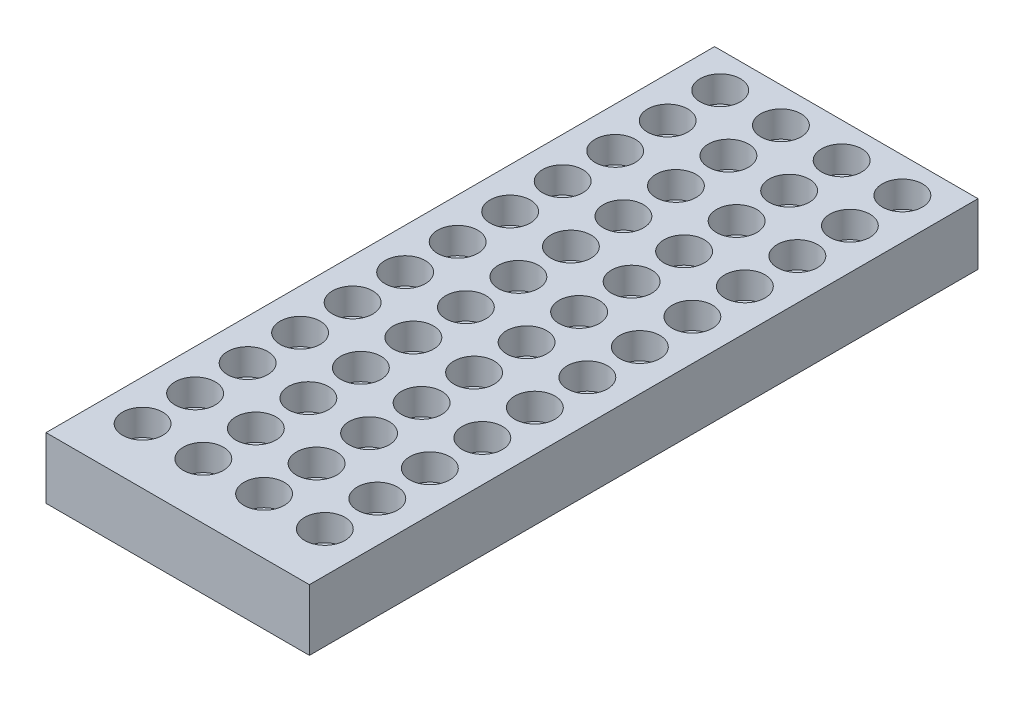
from build123d import *

# Parameters (mm, degrees)
SKETCH1_W           = 75.25
SKETCH1_H           = 191
SKETCH1_R           = 5.75
BOSS_EXTRUDE1_DEPTH = 7.5
SKETCH3_W           = 75.25
SKETCH3_H           = 191
BOSS_EXTRUDE2_DEPTH = 10


with BuildPart() as part:
    # Sketch1 → Boss-Extrude1 (new body)
    with BuildSketch(Plane(origin=(0, 0, 0), x_dir=(1, 0, 0), z_dir=(0, 1, 0))):
        Rectangle(SKETCH1_W, SKETCH1_H)
        with Locations((-26.025, 85.5)):
            Circle(SKETCH1_R, mode=Mode.SUBTRACT)
        with Locations((-8.675, 85.5)):
            Circle(SKETCH1_R, mode=Mode.SUBTRACT)
        with Locations((8.675, 85.5)):
            Circle(SKETCH1_R, mode=Mode.SUBTRACT)
        with Locations((26.025, 85.5)):
            Circle(SKETCH1_R, mode=Mode.SUBTRACT)
        with Locations((-26.025, 70.5)):
            Circle(SKETCH1_R, mode=Mode.SUBTRACT)
        with Locations((-8.675, 70.5)):
            Circle(SKETCH1_R, mode=Mode.SUBTRACT)
        with Locations((8.675, 70.5)):
            Circle(SKETCH1_R, mode=Mode.SUBTRACT)
        with Locations((26.025, 70.5)):
            Circle(SKETCH1_R, mode=Mode.SUBTRACT)
        with Locations((-26.025, 55.5)):
            Circle(SKETCH1_R, mode=Mode.SUBTRACT)
        with Locations((-8.675, 55.5)):
            Circle(SKETCH1_R, mode=Mode.SUBTRACT)
        with Locations((8.675, 55.5)):
            Circle(SKETCH1_R, mode=Mode.SUBTRACT)
        with Locations((26.025, 55.5)):
            Circle(SKETCH1_R, mode=Mode.SUBTRACT)
        with Locations((-26.025, 40.5)):
            Circle(SKETCH1_R, mode=Mode.SUBTRACT)
        with Locations((-8.675, 40.5)):
            Circle(SKETCH1_R, mode=Mode.SUBTRACT)
        with Locations((8.675, 40.5)):
            Circle(SKETCH1_R, mode=Mode.SUBTRACT)
        with Locations((26.025, 40.5)):
            Circle(SKETCH1_R, mode=Mode.SUBTRACT)
        with Locations((-26.025, 25.5)):
            Circle(SKETCH1_R, mode=Mode.SUBTRACT)
        with Locations((-8.675, 25.5)):
            Circle(SKETCH1_R, mode=Mode.SUBTRACT)
        with Locations((8.675, 25.5)):
            Circle(SKETCH1_R, mode=Mode.SUBTRACT)
        with Locations((26.025, 25.5)):
            Circle(SKETCH1_R, mode=Mode.SUBTRACT)
        with Locations((-26.025, 10.5)):
            Circle(SKETCH1_R, mode=Mode.SUBTRACT)
        with Locations((-8.675, 10.5)):
            Circle(SKETCH1_R, mode=Mode.SUBTRACT)
        with Locations((8.675, 10.5)):
            Circle(SKETCH1_R, mode=Mode.SUBTRACT)
        with Locations((26.025, 10.5)):
            Circle(SKETCH1_R, mode=Mode.SUBTRACT)
        with Locations((-26.025, -4.5)):
            Circle(SKETCH1_R, mode=Mode.SUBTRACT)
        with Locations((-8.675, -4.5)):
            Circle(SKETCH1_R, mode=Mode.SUBTRACT)
        with Locations((8.675, -4.5)):
            Circle(SKETCH1_R, mode=Mode.SUBTRACT)
        with Locations((26.025, -4.5)):
            Circle(SKETCH1_R, mode=Mode.SUBTRACT)
        with Locations((-26.025, -19.5)):
            Circle(SKETCH1_R, mode=Mode.SUBTRACT)
        with Locations((-8.675, -19.5)):
            Circle(SKETCH1_R, mode=Mode.SUBTRACT)
        with Locations((8.675, -19.5)):
            Circle(SKETCH1_R, mode=Mode.SUBTRACT)
        with Locations((26.025, -19.5)):
            Circle(SKETCH1_R, mode=Mode.SUBTRACT)
        with Locations((-26.025, -34.5)):
            Circle(SKETCH1_R, mode=Mode.SUBTRACT)
        with Locations((-8.675, -34.5)):
            Circle(SKETCH1_R, mode=Mode.SUBTRACT)
        with Locations((8.675, -34.5)):
            Circle(SKETCH1_R, mode=Mode.SUBTRACT)
        with Locations((26.025, -34.5)):
            Circle(SKETCH1_R, mode=Mode.SUBTRACT)
        with Locations((-26.025, -49.5)):
            Circle(SKETCH1_R, mode=Mode.SUBTRACT)
        with Locations((-8.675, -49.5)):
            Circle(SKETCH1_R, mode=Mode.SUBTRACT)
        with Locations((8.675, -49.5)):
            Circle(SKETCH1_R, mode=Mode.SUBTRACT)
        with Locations((26.025, -49.5)):
            Circle(SKETCH1_R, mode=Mode.SUBTRACT)
        with Locations((-26.025, -64.5)):
            Circle(SKETCH1_R, mode=Mode.SUBTRACT)
        with Locations((-8.675, -64.5)):
            Circle(SKETCH1_R, mode=Mode.SUBTRACT)
        with Locations((8.675, -64.5)):
            Circle(SKETCH1_R, mode=Mode.SUBTRACT)
        with Locations((26.025, -64.5)):
            Circle(SKETCH1_R, mode=Mode.SUBTRACT)
        with Locations((-26.025, -79.5)):
            Circle(SKETCH1_R, mode=Mode.SUBTRACT)
        with Locations((-8.675, -79.5)):
            Circle(SKETCH1_R, mode=Mode.SUBTRACT)
        with Locations((8.675, -79.5)):
            Circle(SKETCH1_R, mode=Mode.SUBTRACT)
        with Locations((26.025, -79.5)):
            Circle(SKETCH1_R, mode=Mode.SUBTRACT)
    extrude(amount=BOSS_EXTRUDE1_DEPTH)

    # Sketch3 → Boss-Extrude2 (add)
    with BuildSketch(Plane.XZ):
        Rectangle(SKETCH3_W, SKETCH3_H)
    extrude(amount=BOSS_EXTRUDE2_DEPTH)


solid = part.part
